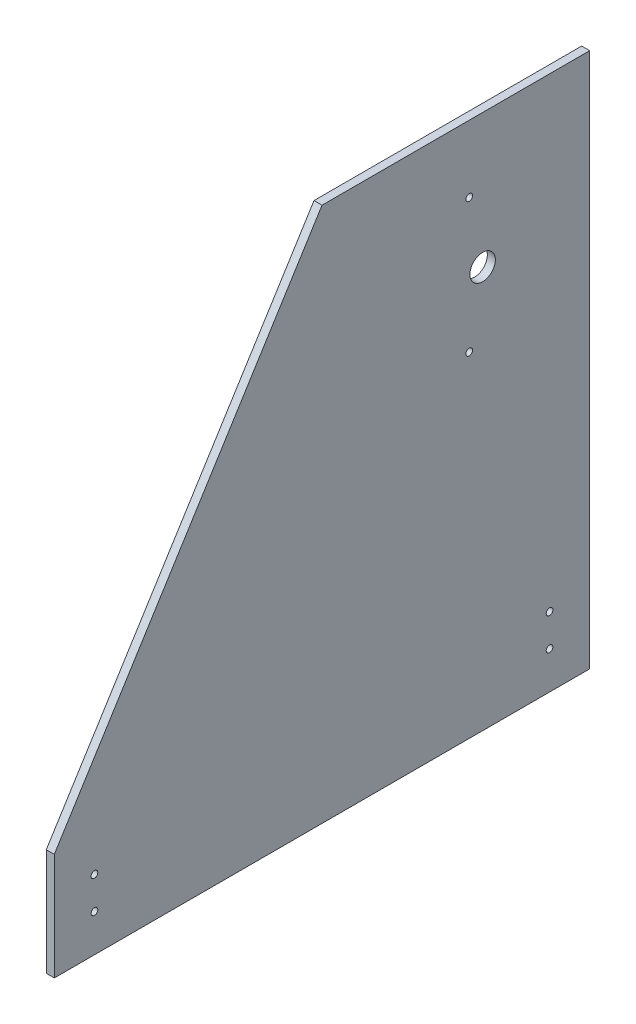
from build123d import *

# Parameters (mm, degrees)
SKETCH1_R           = 2.5
SKETCH1_R_2         = 9.5
BOSS_EXTRUDE1_DEPTH = 6


with BuildPart() as part:
    # Sketch1 → Boss-Extrude1 (new body)
    with BuildSketch(Plane(origin=(0, 0, 0), x_dir=(0, 0, -1), z_dir=(1, 0, 0))):
        Polygon((0, 0), (400, 0), (400, 400), (200, 400), (0, 80), align=None)
        with Locations((30, 52)):
            Circle(SKETCH1_R, mode=Mode.SUBTRACT)
        with Locations((30, 28)):
            Circle(SKETCH1_R, mode=Mode.SUBTRACT)
        with Locations((370, 28)):
            Circle(SKETCH1_R, mode=Mode.SUBTRACT)
        with Locations((370, 52)):
            Circle(SKETCH1_R, mode=Mode.SUBTRACT)
        with Locations((310, 350)):
            Circle(SKETCH1_R, mode=Mode.SUBTRACT)
        with Locations((310, 250)):
            Circle(SKETCH1_R, mode=Mode.SUBTRACT)
        with Locations((320, 300)):
            Circle(SKETCH1_R_2, mode=Mode.SUBTRACT)
    extrude(amount=BOSS_EXTRUDE1_DEPTH)


solid = part.part
